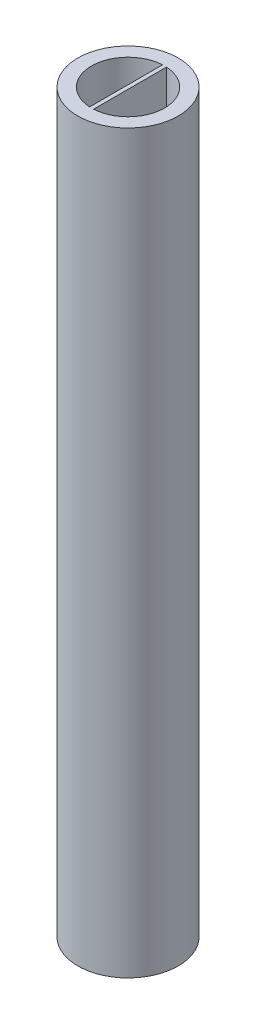
from build123d import *

# Parameters (mm, degrees)
SKETCH1_R           = 3.55
BOSS_EXTRUDE1_DEPTH = 52


with BuildPart() as part:
    # Sketch1 → Boss-Extrude1 (new body)
    with BuildSketch(Plane(origin=(0, 0, 0), x_dir=(1, 0, 0), z_dir=(0, 1, 0))):
        Circle(SKETCH1_R)
        with BuildLine():
            Line((-0.136858924, 2.576367527), (-0.136858924, -2.576367527))
            ThreePointArc((-0.136858924, -2.576367527), (-2.58, 0), (-0.136858924, 2.576367527))
        make_face(mode=Mode.SUBTRACT)
        with BuildLine():
            Line((0.139548639, 2.576223239), (0.139548639, -2.576223239))
            ThreePointArc((0.139548639, -2.576223239), (2.58, 0), (0.139548639, 2.576223239))
        make_face(mode=Mode.SUBTRACT)
    extrude(amount=BOSS_EXTRUDE1_DEPTH)


solid = part.part
